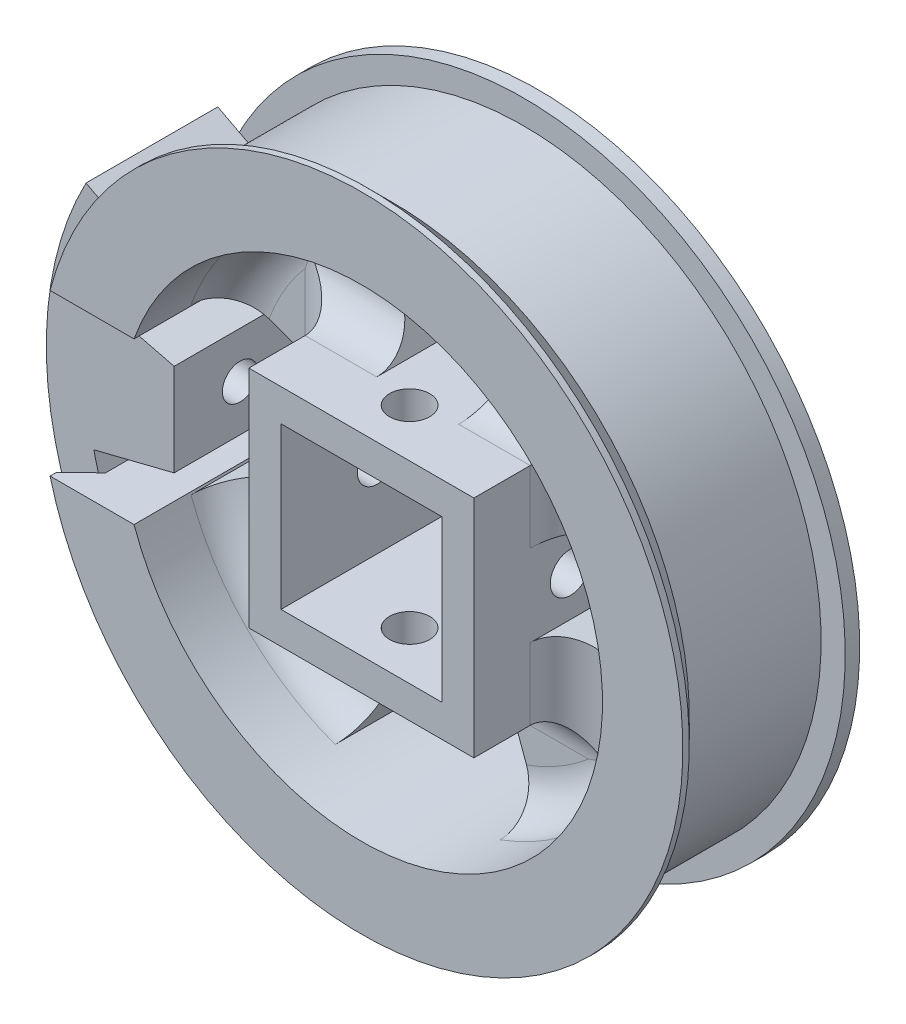
from build123d import *

# Parameters (mm, degrees)
SKIZZE1_R                                    = 40
SKIZZE1_W                                    = 20
SKIZZE1_H                                    = 20
AUFSATZ_LINEAR_AUSTRAGEN1_DEPTH              = 20
SKIZZE2_R                                    = 30
SCHNITT_LINEAR_AUSTRAGEN1_DEPTH              = 10
SKIZZE4_W                                    = 5
SKIZZE4_H                                    = 16.4
SKIZZE5_W                                    = 11.715729
SKIZZE5_H                                    = 20
SCHNITT_LINEAR_AUSTRAGEN5_DEPTH              = 61
AUFSATZ_LINEAR_START                         = 18.2
AUFSATZ_LINEAR_AUSTRAGEN2_DEPTH              = 16.4
SKIZZE7_R                                    = 2.2
SCHNITT_LINEAR_AUSTRAGEN6_DEPTH              = 81.633514
SCHNITT_LINEAR_START                         = -10.964007
SKIZZE7_3_R                                  = 4
SCHNITT_LINEAR_AUSTRAGEN7_DEPTH              = 70.669507
FL_CHE_VERSCHIEBEN1_BY                       = 2
FASE2_SIZE                                   = 3
SCHNITT_LINEAR_AUSTRAGEN8_DEPTH              = 63.713635
KREISMUSTER1_COUNT                           = 4
SKIZZE1_2_W                                  = 28
SKIZZE1_2_H                                  = 28
SKIZZE1_2_W_2                                = 20
SKIZZE1_2_H_2                                = 20
LINEAR_AUSTRAGEN_D_NN1_DEPTH                 = 22
SCHNITT_LINEAR_AUSTRAGEN9_DEPTH              = 14
SCHNITT_LINEAR_AUSTRAGEN9_DEPTH_BACK         = 14
SKIZZE11_R                                   = 2.5
SCHNITT_LINEAR_AUSTRAGEN10_REACH             = 64.714
SKIZZE12_R                                   = 2.5
SCHNITT_LINEAR_AUSTRAGEN10_DIRECTION_2_REACH = 64.714
VERRUNDUNG2_R                                = 5


# Some blends are built 0.0001 mm under size
with BuildPart() as part:
    # Skizze1 → Aufsatz-Linear austragen1 (new body)
    with BuildSketch(Plane.XY):
        Circle(SKIZZE1_R)
        Rectangle(SKIZZE1_W, SKIZZE1_H, mode=Mode.SUBTRACT)
    extrude(amount=AUFSATZ_LINEAR_AUSTRAGEN1_DEPTH)

    # Skizze2 → Schnitt-Linear austragen1 (cut)
    with BuildSketch(Plane.XY.offset(20)):
        Circle(SKIZZE2_R)
    extrude(amount=-SCHNITT_LINEAR_AUSTRAGEN1_DEPTH, mode=Mode.SUBTRACT)

    # Skizze4 → Schnitt-Rotation1 (revolve, cut)
    with BuildSketch(Plane(origin=(0, 0, 0), x_dir=(1, 0, 0), z_dir=(0, 1, 0)), mode=Mode.PRIVATE) as schnitt_rotation1_sk:
        with Locations((39.5, -10)):
            Rectangle(SKIZZE4_W, SKIZZE4_H)
    revolve(schnitt_rotation1_sk.sketch.rotate(Axis((0, 0, 0), (0, 0, 1)), 180), axis=Axis((0, 0, 0), (0, 0, 1)), mode=Mode.SUBTRACT)

    # Skizze5 → Schnitt-Linear austragen5 (cut, through all)
    with BuildSketch(Plane.XY):
        with Locations((-34.142136, 0)):
            Rectangle(SKIZZE5_W, SKIZZE5_H)
    extrude(amount=SCHNITT_LINEAR_AUSTRAGEN5_DEPTH, mode=Mode.SUBTRACT)

    # Fläche verschieben1: a face moved outward by 2.0
    extrude(part.faces().sort_by_distance((0.635083, -32, 20))[0], amount=FL_CHE_VERSCHIEBEN1_BY, dir=(0, 0, 1))

    # Fase2
    fase2_edges = [part.edges().sort_by_distance(p)[0] for p in [
        (40, 0, 18.2),
    ]]
    chamfer(fase2_edges, length=FASE2_SIZE - 0.0001)  # a hair under: the kernel refuses the full size

    # Skizze10 → Schnitt-Linear austragen8 (cut, through all)
    with BuildSketch(Plane.XY):
        with BuildLine():
            Line((10.260604, 28.190779), (5.095583, 14))
            Line((5.095583, 14), (-5.095583, 14))
            Line((-5.095583, 14), (-10.260604, 28.190779))
            ThreePointArc((-10.260604, 28.190779), (0, 30), (10.260604, 28.190779))
        make_face()
    schnitt_linear_austragen8 = extrude(amount=SCHNITT_LINEAR_AUSTRAGEN8_DEPTH, mode=Mode.SUBTRACT)

    # Kreismuster1: Schnitt-Linear austragen8 ×4 about axis
    kreismuster1_axis = Axis((0, 0, 0), (0, 0, 1))
    for i in range(1, KREISMUSTER1_COUNT):
        add(schnitt_linear_austragen8.rotate(kreismuster1_axis, i * 360 / KREISMUSTER1_COUNT), mode=Mode.SUBTRACT)

    # Skizze1<2> → Linear-Austragen-Dünn1 (add)
    with BuildSketch(Plane.XY):
        Rectangle(SKIZZE1_2_W, SKIZZE1_2_H)
        Rectangle(SKIZZE1_2_W_2, SKIZZE1_2_H_2, mode=Mode.SUBTRACT)
    extrude(amount=LINEAR_AUSTRAGEN_D_NN1_DEPTH)

    # Skizze11 → Schnitt-Linear austragen9 (cut, two sides: drawn at the far end of the back side and taken through both)
    with BuildSketch(Plane(origin=(0, 0, 0), x_dir=(1, 0, 0), z_dir=(0, 1, 0)).offset(-SCHNITT_LINEAR_AUSTRAGEN9_DEPTH_BACK)):
        with Locations(Location((0, -16, 0), (0, 0, 270))):
            Circle(SKIZZE11_R)
    extrude(amount=SCHNITT_LINEAR_AUSTRAGEN9_DEPTH + SCHNITT_LINEAR_AUSTRAGEN9_DEPTH_BACK, mode=Mode.SUBTRACT)

    # Schnitt-Linear austragen10: up to this face of the body (flat: up to its plane)
    schnitt_linear_austragen10_end = Plane(part.part.faces().sort_by_distance((-14, 0, 13.440058))[0])
    # Skizze12 → Schnitt-Linear austragen10 (cut, up to the picked face)
    with BuildSketch(Plane(origin=(0, 0, 0), x_dir=(0, 0, -1), z_dir=(1, 0, 0)), mode=Mode.PRIVATE) as schnitt_linear_austragen10_sk1:
        with Locations(Location((-10, 0, 0), (0, 0, 90))):
            Circle(SKIZZE12_R)
    schnitt_linear_austragen10_tool1 = split(extrude(schnitt_linear_austragen10_sk1.sketch, amount=-SCHNITT_LINEAR_AUSTRAGEN10_REACH, mode=Mode.PRIVATE), bisect_by=schnitt_linear_austragen10_end, keep=Keep.BOTH, mode=Mode.PRIVATE)
    add(schnitt_linear_austragen10_tool1.solids().sort_by(Axis((0, 0, 10), (-1, 0, 0)))[0], mode=Mode.SUBTRACT)

    # Schnitt-Linear austragen10 direction 2: up to this face of the body (flat: up to its plane)
    schnitt_linear_austragen10_direction_2_end = Plane(part.part.faces().sort_by_distance((14, 0, 13.440058))[0])
    # Skizze12 → Schnitt-Linear austragen10 direction 2 (cut, up to the picked face)
    with BuildSketch(Plane(origin=(0, 0, 0), x_dir=(0, 0, -1), z_dir=(1, 0, 0)), mode=Mode.PRIVATE) as schnitt_linear_austragen10_direction_2_sk1:
        with Locations(Location((-10, 0, 0), (0, 0, 90))):
            Circle(SKIZZE12_R)
    schnitt_linear_austragen10_direction_2_tool1 = split(extrude(schnitt_linear_austragen10_direction_2_sk1.sketch, amount=SCHNITT_LINEAR_AUSTRAGEN10_DIRECTION_2_REACH, mode=Mode.PRIVATE), bisect_by=schnitt_linear_austragen10_direction_2_end, keep=Keep.BOTH, mode=Mode.PRIVATE)
    add(schnitt_linear_austragen10_direction_2_tool1.solids().sort_by(Axis((0, 0, 10), (1, 0, 0)))[0], mode=Mode.SUBTRACT)

    # Verrundung2
    # the kernel refuses this fillet: 5 mm, written as the material it adds along each edge
    with BuildSketch(Plane(origin=(0, 0, 10), x_dir=(-0.9396926207859098, 0.3420201433256648, 0), z_dir=(-0.3420201433256648, -0.9396926207859098, 0))) as verrundung2_piece_1:
        with BuildLine():
            CenterArc((30 - VERRUNDUNG2_R, -VERRUNDUNG2_R), VERRUNDUNG2_R, 0, 90)
            Line((30 - VERRUNDUNG2_R, 0), (30, 0))
            Line((30, 0), (30, -VERRUNDUNG2_R))
        make_face()
    revolve(axis=Axis((0, 0, 10), (0, 0, -1)), revolution_arc=50)
    with BuildSketch(Plane(origin=(0, 0, 10), x_dir=(0.9396926207859116, -0.34202014332565983, 0), z_dir=(0.34202014332565983, 0.9396926207859116, 0))) as verrundung2_piece_2:
        with BuildLine():
            CenterArc((30 - VERRUNDUNG2_R, -VERRUNDUNG2_R), VERRUNDUNG2_R, 0, 90)
            Line((30 - VERRUNDUNG2_R, 0), (30, 0))
            Line((30, 0), (30, -VERRUNDUNG2_R))
        make_face()
    revolve(axis=Axis((0, 0, 10), (0, 0, -1)), revolution_arc=50)
    with BuildSketch(Plane(origin=(0, 0, 10), x_dir=(-0.34202014332568725, -0.9396926207859017, 0), z_dir=(0.9396926207859017, -0.34202014332568725, 0))) as verrundung2_piece_3:
        with BuildLine():
            CenterArc((30 - VERRUNDUNG2_R, -VERRUNDUNG2_R), VERRUNDUNG2_R, 0, 90)
            Line((30 - VERRUNDUNG2_R, 0), (30, 0))
            Line((30, 0), (30, -VERRUNDUNG2_R))
        make_face()
    revolve(axis=Axis((0, 0, 10), (0, 0, -1)), revolution_arc=50)
    with BuildSketch(Plane(origin=(14, 14, 10), x_dir=(0, 1, 0), z_dir=(-1, 0, 0))) as verrundung2_piece_4_section:
        with BuildLine():
            CenterArc((VERRUNDUNG2_R, -VERRUNDUNG2_R), VERRUNDUNG2_R, 90, 90)
            Line((0, -VERRUNDUNG2_R), (0, 0))
            Line((0, 0), (VERRUNDUNG2_R, 0))
        make_face()
    verrundung2_piece_4 = extrude(amount=21.404417, mode=Mode.PRIVATE)
    verrundung2_piece_4 = split(verrundung2_piece_4, bisect_by=Plane(origin=(5.987236, 16.449795, 11.161394), z_dir=(0.9396926207859081, -0.3420201433256697, 0)), keep=Keep.TOP, mode=Mode.PRIVATE)
    add(verrundung2_piece_4)
    with BuildSketch(Plane(origin=(14, 14, 10), x_dir=(0, 1, 0), z_dir=(-1, 0, 0))) as verrundung2_piece_5_section:
        with BuildLine():
            CenterArc((VERRUNDUNG2_R, -VERRUNDUNG2_R), VERRUNDUNG2_R, 90, 90)
            Line((0, -VERRUNDUNG2_R), (0, 0))
            Line((0, 0), (VERRUNDUNG2_R, 0))
        make_face()
    verrundung2_piece_5 = extrude(amount=21.404417, mode=Mode.PRIVATE)
    verrundung2_piece_5 = split(verrundung2_piece_5, bisect_by=Plane(origin=(-5.54213, 15.226878, 11.263688), z_dir=(-0.9396926207859081, -0.3420201433256697, 0)), keep=Keep.TOP, mode=Mode.PRIVATE)
    add(verrundung2_piece_5)
    with BuildSketch(Plane(origin=(7.404417, 14, 10), x_dir=(0, 1, 0), z_dir=(-1, 0, 0))) as verrundung2_piece_6_section:
        with BuildLine():
            CenterArc((VERRUNDUNG2_R, -VERRUNDUNG2_R), VERRUNDUNG2_R, 90, 90)
            Line((0, -VERRUNDUNG2_R), (0, 0))
            Line((0, 0), (VERRUNDUNG2_R, 0))
        make_face()
    verrundung2_piece_6 = extrude(amount=21.404417, mode=Mode.PRIVATE)
    verrundung2_piece_6 = split(verrundung2_piece_6, bisect_by=Plane(origin=(5.54213, 15.226878, 11.263688), z_dir=(0.9396926207859081, -0.3420201433256697, 0)), keep=Keep.TOP, mode=Mode.PRIVATE)
    add(verrundung2_piece_6)
    with BuildSketch(Plane(origin=(7.404417, 14, 10), x_dir=(0, 1, 0), z_dir=(-1, 0, 0))) as verrundung2_piece_7_section:
        with BuildLine():
            CenterArc((VERRUNDUNG2_R, -VERRUNDUNG2_R), VERRUNDUNG2_R, 90, 90)
            Line((0, -VERRUNDUNG2_R), (0, 0))
            Line((0, 0), (VERRUNDUNG2_R, 0))
        make_face()
    verrundung2_piece_7 = extrude(amount=21.404417, mode=Mode.PRIVATE)
    verrundung2_piece_7 = split(verrundung2_piece_7, bisect_by=Plane(origin=(-5.987236, 16.449795, 11.161394), z_dir=(-0.9396926207859081, -0.3420201433256697, 0)), keep=Keep.TOP, mode=Mode.PRIVATE)
    add(verrundung2_piece_7)
    with BuildSketch(Plane(origin=(-14, 7.404417, 10), x_dir=(-1, 0, 0), z_dir=(0, -1, 0))) as verrundung2_piece_8_section:
        with BuildLine():
            CenterArc((VERRUNDUNG2_R, -VERRUNDUNG2_R), VERRUNDUNG2_R, 90, 90)
            Line((0, -VERRUNDUNG2_R), (0, 0))
            Line((0, 0), (VERRUNDUNG2_R, 0))
        make_face()
    verrundung2_piece_8 = extrude(amount=21.404417, mode=Mode.PRIVATE)
    verrundung2_piece_8 = split(verrundung2_piece_8, bisect_by=Plane(origin=(-15.226878, 5.54213, 11.263688), z_dir=(0.3420201433256698, 0.9396926207859081, 0)), keep=Keep.TOP, mode=Mode.PRIVATE)
    add(verrundung2_piece_8)
    with BuildSketch(Plane(origin=(-14, 7.404417, 10), x_dir=(-1, 0, 0), z_dir=(0, -1, 0))) as verrundung2_piece_9_section:
        with BuildLine():
            CenterArc((VERRUNDUNG2_R, -VERRUNDUNG2_R), VERRUNDUNG2_R, 90, 90)
            Line((0, -VERRUNDUNG2_R), (0, 0))
            Line((0, 0), (VERRUNDUNG2_R, 0))
        make_face()
    verrundung2_piece_9 = extrude(amount=21.404417, mode=Mode.PRIVATE)
    verrundung2_piece_9 = split(verrundung2_piece_9, bisect_by=Plane(origin=(-16.449795, -5.987236, 11.161394), z_dir=(0.3420201433256696, -0.9396926207859081, 0)), keep=Keep.TOP, mode=Mode.PRIVATE)
    add(verrundung2_piece_9)
    with BuildSketch(Plane(origin=(-14, 14, 10), x_dir=(-1, 0, 0), z_dir=(0, -1, 0))) as verrundung2_piece_10_section:
        with BuildLine():
            CenterArc((VERRUNDUNG2_R, -VERRUNDUNG2_R), VERRUNDUNG2_R, 90, 90)
            Line((0, -VERRUNDUNG2_R), (0, 0))
            Line((0, 0), (VERRUNDUNG2_R, 0))
        make_face()
    verrundung2_piece_10 = extrude(amount=21.404417, mode=Mode.PRIVATE)
    verrundung2_piece_10 = split(verrundung2_piece_10, bisect_by=Plane(origin=(-16.449795, 5.987236, 11.161394), z_dir=(0.3420201433256698, 0.9396926207859081, 0)), keep=Keep.TOP, mode=Mode.PRIVATE)
    add(verrundung2_piece_10)
    with BuildSketch(Plane(origin=(-14, 14, 10), x_dir=(-1, 0, 0), z_dir=(0, -1, 0))) as verrundung2_piece_11_section:
        with BuildLine():
            CenterArc((VERRUNDUNG2_R, -VERRUNDUNG2_R), VERRUNDUNG2_R, 90, 90)
            Line((0, -VERRUNDUNG2_R), (0, 0))
            Line((0, 0), (VERRUNDUNG2_R, 0))
        make_face()
    verrundung2_piece_11 = extrude(amount=21.404417, mode=Mode.PRIVATE)
    verrundung2_piece_11 = split(verrundung2_piece_11, bisect_by=Plane(origin=(-15.226878, -5.54213, 11.263688), z_dir=(0.3420201433256696, -0.9396926207859081, 0)), keep=Keep.TOP, mode=Mode.PRIVATE)
    add(verrundung2_piece_11)
    with BuildSketch(Plane(origin=(14, -14, 10), x_dir=(1, 0, 0), z_dir=(0, 1, 0))) as verrundung2_piece_12_section:
        with BuildLine():
            CenterArc((VERRUNDUNG2_R, -VERRUNDUNG2_R), VERRUNDUNG2_R, 90, 90)
            Line((0, -VERRUNDUNG2_R), (0, 0))
            Line((0, 0), (VERRUNDUNG2_R, 0))
        make_face()
    verrundung2_piece_12 = extrude(amount=21.404417, mode=Mode.PRIVATE)
    verrundung2_piece_12 = split(verrundung2_piece_12, bisect_by=Plane(origin=(16.449795, -5.987236, 11.161394), z_dir=(-0.34202014332566993, -0.939692620785908, 0)), keep=Keep.TOP, mode=Mode.PRIVATE)
    add(verrundung2_piece_12)
    with BuildSketch(Plane(origin=(14, -14, 10), x_dir=(1, 0, 0), z_dir=(0, 1, 0))) as verrundung2_piece_13_section:
        with BuildLine():
            CenterArc((VERRUNDUNG2_R, -VERRUNDUNG2_R), VERRUNDUNG2_R, 90, 90)
            Line((0, -VERRUNDUNG2_R), (0, 0))
            Line((0, 0), (VERRUNDUNG2_R, 0))
        make_face()
    verrundung2_piece_13 = extrude(amount=21.404417, mode=Mode.PRIVATE)
    verrundung2_piece_13 = split(verrundung2_piece_13, bisect_by=Plane(origin=(15.226878, 5.54213, 11.263688), z_dir=(-0.3420201433256695, 0.9396926207859082, 0)), keep=Keep.TOP, mode=Mode.PRIVATE)
    add(verrundung2_piece_13)
    with BuildSketch(Plane(origin=(14, -7.404417, 10), x_dir=(1, 0, 0), z_dir=(0, 1, 0))) as verrundung2_piece_14_section:
        with BuildLine():
            CenterArc((VERRUNDUNG2_R, -VERRUNDUNG2_R), VERRUNDUNG2_R, 90, 90)
            Line((0, -VERRUNDUNG2_R), (0, 0))
            Line((0, 0), (VERRUNDUNG2_R, 0))
        make_face()
    verrundung2_piece_14 = extrude(amount=21.404417, mode=Mode.PRIVATE)
    verrundung2_piece_14 = split(verrundung2_piece_14, bisect_by=Plane(origin=(15.226878, -5.54213, 11.263688), z_dir=(-0.34202014332566993, -0.939692620785908, 0)), keep=Keep.TOP, mode=Mode.PRIVATE)
    add(verrundung2_piece_14)
    with BuildSketch(Plane(origin=(14, -7.404417, 10), x_dir=(1, 0, 0), z_dir=(0, 1, 0))) as verrundung2_piece_15_section:
        with BuildLine():
            CenterArc((VERRUNDUNG2_R, -VERRUNDUNG2_R), VERRUNDUNG2_R, 90, 90)
            Line((0, -VERRUNDUNG2_R), (0, 0))
            Line((0, 0), (VERRUNDUNG2_R, 0))
        make_face()
    verrundung2_piece_15 = extrude(amount=21.404417, mode=Mode.PRIVATE)
    verrundung2_piece_15 = split(verrundung2_piece_15, bisect_by=Plane(origin=(16.449795, 5.987236, 11.161394), z_dir=(-0.3420201433256695, 0.9396926207859082, 0)), keep=Keep.TOP, mode=Mode.PRIVATE)
    add(verrundung2_piece_15)
    with BuildSketch(Plane(origin=(-7.404417, -14, 10), x_dir=(0, -1, 0), z_dir=(1, 0, 0))) as verrundung2_piece_16_section:
        with BuildLine():
            CenterArc((VERRUNDUNG2_R, -VERRUNDUNG2_R), VERRUNDUNG2_R, 90, 90)
            Line((0, -VERRUNDUNG2_R), (0, 0))
            Line((0, 0), (VERRUNDUNG2_R, 0))
        make_face()
    verrundung2_piece_16 = extrude(amount=21.404417, mode=Mode.PRIVATE)
    verrundung2_piece_16 = split(verrundung2_piece_16, bisect_by=Plane(origin=(-5.54213, -15.226878, 11.263688), z_dir=(-0.9396926207859081, 0.3420201433256698, 0)), keep=Keep.TOP, mode=Mode.PRIVATE)
    add(verrundung2_piece_16)
    with BuildSketch(Plane(origin=(-7.404417, -14, 10), x_dir=(0, -1, 0), z_dir=(1, 0, 0))) as verrundung2_piece_17_section:
        with BuildLine():
            CenterArc((VERRUNDUNG2_R, -VERRUNDUNG2_R), VERRUNDUNG2_R, 90, 90)
            Line((0, -VERRUNDUNG2_R), (0, 0))
            Line((0, 0), (VERRUNDUNG2_R, 0))
        make_face()
    verrundung2_piece_17 = extrude(amount=21.404417, mode=Mode.PRIVATE)
    verrundung2_piece_17 = split(verrundung2_piece_17, bisect_by=Plane(origin=(5.987236, -16.449795, 11.161394), z_dir=(0.9396926207859081, 0.3420201433256696, 0)), keep=Keep.TOP, mode=Mode.PRIVATE)
    add(verrundung2_piece_17)
    with BuildSketch(Plane(origin=(-14, -14, 10), x_dir=(0, -1, 0), z_dir=(1, 0, 0))) as verrundung2_piece_18_section:
        with BuildLine():
            CenterArc((VERRUNDUNG2_R, -VERRUNDUNG2_R), VERRUNDUNG2_R, 90, 90)
            Line((0, -VERRUNDUNG2_R), (0, 0))
            Line((0, 0), (VERRUNDUNG2_R, 0))
        make_face()
    verrundung2_piece_18 = extrude(amount=21.404417, mode=Mode.PRIVATE)
    verrundung2_piece_18 = split(verrundung2_piece_18, bisect_by=Plane(origin=(-5.987236, -16.449795, 11.161394), z_dir=(-0.9396926207859081, 0.3420201433256698, 0)), keep=Keep.TOP, mode=Mode.PRIVATE)
    add(verrundung2_piece_18)
    with BuildSketch(Plane(origin=(-14, -14, 10), x_dir=(0, -1, 0), z_dir=(1, 0, 0))) as verrundung2_piece_19_section:
        with BuildLine():
            CenterArc((VERRUNDUNG2_R, -VERRUNDUNG2_R), VERRUNDUNG2_R, 90, 90)
            Line((0, -VERRUNDUNG2_R), (0, 0))
            Line((0, 0), (VERRUNDUNG2_R, 0))
        make_face()
    verrundung2_piece_19 = extrude(amount=21.404417, mode=Mode.PRIVATE)
    verrundung2_piece_19 = split(verrundung2_piece_19, bisect_by=Plane(origin=(5.54213, -15.226878, 11.263688), z_dir=(0.9396926207859081, 0.3420201433256696, 0)), keep=Keep.TOP, mode=Mode.PRIVATE)
    add(verrundung2_piece_19)
    with BuildSketch(Plane(origin=(0, 0, 10), x_dir=(0.3420201433256675, 0.9396926207859089, 0), z_dir=(-0.9396926207859089, 0.3420201433256675, 0))) as verrundung2_piece_20:
        with BuildLine():
            CenterArc((30 - VERRUNDUNG2_R, -VERRUNDUNG2_R), VERRUNDUNG2_R, 0, 90)
            Line((30 - VERRUNDUNG2_R, 0), (30, 0))
            Line((30, 0), (30, -VERRUNDUNG2_R))
        make_face()
    revolve(axis=Axis((0, 0, 10), (0, 0, -1)), revolution_arc=50)
    with BuildSketch(Plane(origin=(14, -7.404417, 10), x_dir=(1, 0, 0), z_dir=(0, 1, 0))) as verrundung2_piece_21a_section:
        with BuildLine():
            CenterArc((VERRUNDUNG2_R, -VERRUNDUNG2_R), VERRUNDUNG2_R, 90, 90)
            Line((0, -VERRUNDUNG2_R), (0, 0))
            Line((0, 0), (VERRUNDUNG2_R, 0))
        make_face()
    verrundung2_piece_21a = extrude(amount=33.904417, mode=Mode.PRIVATE)
    verrundung2_piece_21a = split(verrundung2_piece_21a, bisect_by=Plane(origin=(15.131976, 14, 11.131976), z_dir=(0, 1, 0)), keep=Keep.TOP, mode=Mode.PRIVATE)
    with BuildSketch(Plane(origin=(26.5, 14, 10), x_dir=(0, 1, 0), z_dir=(-1, 0, 0))) as verrundung2_piece_21b_section:
        with BuildLine():
            CenterArc((VERRUNDUNG2_R, -VERRUNDUNG2_R), VERRUNDUNG2_R, 90, 90)
            Line((0, -VERRUNDUNG2_R), (0, 0))
            Line((0, 0), (VERRUNDUNG2_R, 0))
        make_face()
    verrundung2_piece_21b = extrude(amount=33.904417, mode=Mode.PRIVATE)
    verrundung2_piece_21b = split(verrundung2_piece_21b, bisect_by=Plane(origin=(14, 15.131976, 11.131976), z_dir=(1, 0, 0)), keep=Keep.TOP, mode=Mode.PRIVATE)
    verrundung2_piece_21 = verrundung2_piece_21a & verrundung2_piece_21b
    add(verrundung2_piece_21)
    with BuildSketch(Plane(origin=(7.404417, 14, 10), x_dir=(0, 1, 0), z_dir=(-1, 0, 0))) as verrundung2_piece_22a_section:
        with BuildLine():
            CenterArc((VERRUNDUNG2_R, -VERRUNDUNG2_R), VERRUNDUNG2_R, 90, 90)
            Line((0, -VERRUNDUNG2_R), (0, 0))
            Line((0, 0), (VERRUNDUNG2_R, 0))
        make_face()
    verrundung2_piece_22a = extrude(amount=33.904417, mode=Mode.PRIVATE)
    verrundung2_piece_22a = split(verrundung2_piece_22a, bisect_by=Plane(origin=(-14, 15.131976, 11.131976), z_dir=(-1, 0, 0)), keep=Keep.TOP, mode=Mode.PRIVATE)
    with BuildSketch(Plane(origin=(-14, 26.5, 10), x_dir=(-1, 0, 0), z_dir=(0, -1, 0))) as verrundung2_piece_22b_section:
        with BuildLine():
            CenterArc((VERRUNDUNG2_R, -VERRUNDUNG2_R), VERRUNDUNG2_R, 90, 90)
            Line((0, -VERRUNDUNG2_R), (0, 0))
            Line((0, 0), (VERRUNDUNG2_R, 0))
        make_face()
    verrundung2_piece_22b = extrude(amount=33.904417, mode=Mode.PRIVATE)
    verrundung2_piece_22b = split(verrundung2_piece_22b, bisect_by=Plane(origin=(-15.131976, 14, 11.131976), z_dir=(0, 1, 0)), keep=Keep.TOP, mode=Mode.PRIVATE)
    verrundung2_piece_22 = verrundung2_piece_22a & verrundung2_piece_22b
    add(verrundung2_piece_22)
    with BuildSketch(Plane(origin=(-14, 7.404417, 10), x_dir=(-1, 0, 0), z_dir=(0, -1, 0))) as verrundung2_piece_23a_section:
        with BuildLine():
            CenterArc((VERRUNDUNG2_R, -VERRUNDUNG2_R), VERRUNDUNG2_R, 90, 90)
            Line((0, -VERRUNDUNG2_R), (0, 0))
            Line((0, 0), (VERRUNDUNG2_R, 0))
        make_face()
    verrundung2_piece_23a = extrude(amount=33.904417, mode=Mode.PRIVATE)
    verrundung2_piece_23a = split(verrundung2_piece_23a, bisect_by=Plane(origin=(-15.131976, -14, 11.131976), z_dir=(0, -1, 0)), keep=Keep.TOP, mode=Mode.PRIVATE)
    with BuildSketch(Plane(origin=(-26.5, -14, 10), x_dir=(0, -1, 0), z_dir=(1, 0, 0))) as verrundung2_piece_23b_section:
        with BuildLine():
            CenterArc((VERRUNDUNG2_R, -VERRUNDUNG2_R), VERRUNDUNG2_R, 90, 90)
            Line((0, -VERRUNDUNG2_R), (0, 0))
            Line((0, 0), (VERRUNDUNG2_R, 0))
        make_face()
    verrundung2_piece_23b = extrude(amount=33.904417, mode=Mode.PRIVATE)
    verrundung2_piece_23b = split(verrundung2_piece_23b, bisect_by=Plane(origin=(-14, -15.131976, 11.131976), z_dir=(-1, 0, 0)), keep=Keep.TOP, mode=Mode.PRIVATE)
    verrundung2_piece_23 = verrundung2_piece_23a & verrundung2_piece_23b
    add(verrundung2_piece_23)
    with BuildSketch(Plane(origin=(-7.404417, -14, 10), x_dir=(0, -1, 0), z_dir=(1, 0, 0))) as verrundung2_piece_24a_section:
        with BuildLine():
            CenterArc((VERRUNDUNG2_R, -VERRUNDUNG2_R), VERRUNDUNG2_R, 90, 90)
            Line((0, -VERRUNDUNG2_R), (0, 0))
            Line((0, 0), (VERRUNDUNG2_R, 0))
        make_face()
    verrundung2_piece_24a = extrude(amount=33.904417, mode=Mode.PRIVATE)
    verrundung2_piece_24a = split(verrundung2_piece_24a, bisect_by=Plane(origin=(14, -15.131976, 11.131976), z_dir=(1, 0, 0)), keep=Keep.TOP, mode=Mode.PRIVATE)
    with BuildSketch(Plane(origin=(14, -26.5, 10), x_dir=(1, 0, 0), z_dir=(0, 1, 0))) as verrundung2_piece_24b_section:
        with BuildLine():
            CenterArc((VERRUNDUNG2_R, -VERRUNDUNG2_R), VERRUNDUNG2_R, 90, 90)
            Line((0, -VERRUNDUNG2_R), (0, 0))
            Line((0, 0), (VERRUNDUNG2_R, 0))
        make_face()
    verrundung2_piece_24b = extrude(amount=33.904417, mode=Mode.PRIVATE)
    verrundung2_piece_24b = split(verrundung2_piece_24b, bisect_by=Plane(origin=(15.131976, -14, 11.131976), z_dir=(0, -1, 0)), keep=Keep.TOP, mode=Mode.PRIVATE)
    verrundung2_piece_24 = verrundung2_piece_24a & verrundung2_piece_24b
    add(verrundung2_piece_24)


with BuildPart() as body_2:
    # Skizze6 → Aufsatz-Linear austragen2 (new body)
    with BuildSketch(Plane.XY.offset(AUFSATZ_LINEAR_START)):
        with BuildLine():
            Line((-27.095183, 5.743019), (-37.095183, 8.243019))
            ThreePointArc((-37.095183, 8.243019), (-35.678195, 13.079234), (-33.633705, 17.685414))
            Line((-33.633705, 17.685414), (-38.059193, 20.012442))
            ThreePointArc((-38.059193, 20.012442), (-43, 0), (-38.059193, -20.012442))
            Line((-38.059193, -20.012442), (-33.633705, -17.685414))
            ThreePointArc((-33.633705, -17.685414), (-35.678195, -13.079234), (-37.095183, -8.243019))
            Line((-37.095183, -8.243019), (-27.095183, -5.743019))
            Line((-27.095183, -5.743019), (-27.095183, 5.743019))
        make_face()
    extrude(amount=-AUFSATZ_LINEAR_AUSTRAGEN2_DEPTH)

    # Skizze7 → Schnitt-Linear austragen6 (cut, through all)
    with BuildSketch(Plane(origin=(-27.095183, 0, 0), x_dir=(0, 0, -1), z_dir=(1, 0, 0))):
        with Locations(Location((-10, 0, 0), (0, 0, 90))):
            Circle(SKIZZE7_R)
    extrude(amount=-SCHNITT_LINEAR_AUSTRAGEN6_DEPTH, mode=Mode.SUBTRACT)

    # Skizze7<3> → Schnitt-Linear austragen7 (cut, through all)
    with BuildSketch(Plane(origin=(-27.095183, 0, 0), x_dir=(0, 0, -1), z_dir=(1, 0, 0)).offset(SCHNITT_LINEAR_START)):
        with Locations(Location((-10, 0, 0), (0, 0, 90))):
            Circle(SKIZZE7_3_R)
    extrude(amount=-SCHNITT_LINEAR_AUSTRAGEN7_DEPTH, mode=Mode.SUBTRACT)


solid = Compound([part.part, body_2.part])
